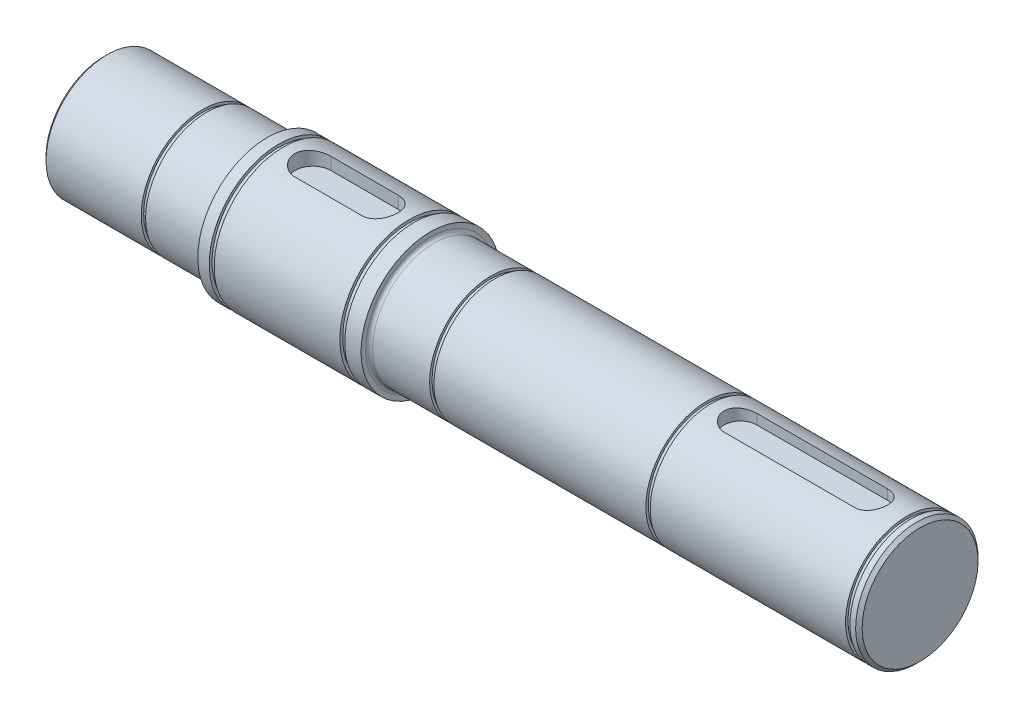
from build123d import *

# Parameters (mm, degrees)
ESQUISSE2_R              = 42.5
ESQUISSE2_R_2            = 40.75
ENL_V_MAT_EXTRU_1_DEPTH  = 3
ESQUISSE3_R              = 42.5
ESQUISSE3_R_2            = 40.75
ENL_V_MAT_EXTRU_2_DEPTH  = 3
ENL_V_MAT_EXTRU_3_DEPTH  = 9
ENL_V_MAT_EXTRU_4_DEPTH  = 7.5
CHANFREIN1_SIZE          = 2
ESQUISSE6_R              = 37.5
ESQUISSE6_R_2            = 36
ENL_V_MAT_EXTRU_5_DEPTH  = 2.65
ENL_V_START              = -2.65
ESQUISSE7_R              = 37.5
ESQUISSE7_R_2            = 36
ENL_V_MAT_EXTRU_6_DEPTH  = 2.65
ESQUISSE8_R              = 37.5
ESQUISSE8_R_2            = 36
ENL_V_MAT_EXTRU_7_DEPTH  = 2.65
ENL_V_START_2            = 2.65
ESQUISSE10_R             = 37.5
ESQUISSE10_R_2           = 36
ENL_V_MAT_EXTRU_11_DEPTH = 2.65


with BuildPart() as part:
    # Esquisse1 → Révolution1 (revolve)
    with BuildSketch(Plane.XY):
        with BuildLine():
            Line((0, 0), (0, 37.5))
            Line((0, 37.5), (97.9, 37.5))
            ThreePointArc((97.9, 37.5), (99.38492424, 38.11507576), (100, 39.6))
            Line((100, 39.6), (100, 42.5))
            Line((100, 42.5), (200, 42.5))
            Line((200, 42.5), (200, 39.6))
            ThreePointArc((200, 39.6), (200.61507576, 38.11507576), (202.1, 37.5))
            Line((202.1, 37.5), (500, 37.5))
            Line((500, 37.5), (500, 0))
            Line((500, 0), (0, 0))
        make_face()
    revolve(axis=Axis((500, 0, 0), (-1, 0, 0)))

    # Esquisse2 → Enlèv. mat.-Extru.1 (cut)
    with BuildSketch(Plane(origin=(110, 0, 0), x_dir=(0, 0, -1), z_dir=(1, 0, 0))):
        Circle(ESQUISSE2_R)
        Circle(ESQUISSE2_R_2, mode=Mode.SUBTRACT)
    extrude(amount=-ENL_V_MAT_EXTRU_1_DEPTH, mode=Mode.SUBTRACT)

    # Esquisse3 → Enlèv. mat.-Extru.2 (cut)
    with BuildSketch(Plane(origin=(190, 0, 0), x_dir=(0, 0, -1), z_dir=(1, 0, 0))):
        Circle(ESQUISSE3_R)
        Circle(ESQUISSE3_R_2, mode=Mode.SUBTRACT)
    extrude(amount=-ENL_V_MAT_EXTRU_2_DEPTH, mode=Mode.SUBTRACT)

    # Esquisse4 → Enlèv. mat.-Extru.3 (cut)
    with BuildSketch(Plane(origin=(0, 42.5, 0), x_dir=(1, 0, 0), z_dir=(0, 1, 0))):
        with BuildLine():
            Line((128, 11), (169, 11))
            ThreePointArc((169, 11), (180, 0), (169, -11))
            Line((169, -11), (128, -11))
            ThreePointArc((128, -11), (117, 0), (128, 11))
        make_face()
    extrude(amount=-ENL_V_MAT_EXTRU_3_DEPTH, mode=Mode.SUBTRACT)

    # Esquisse5 → Enlèv. mat.-Extru.4 (cut)
    with BuildSketch(Plane(origin=(0, 37.5, 0), x_dir=(1, 0, 0), z_dir=(0, 1, 0))):
        with BuildLine():
            Line((470, -10), (390, -10))
            ThreePointArc((390, -10), (380, 0), (390, 10))
            Line((390, 10), (470, 10))
            ThreePointArc((470, 10), (480, 0), (470, -10))
        make_face()
    extrude(amount=-ENL_V_MAT_EXTRU_4_DEPTH, mode=Mode.SUBTRACT)

    # Chanfrein1
    chanfrein1_edges = [part.edges().sort_by_distance(p)[0] for p in [
        (500, -37.5, 0),
        (0, -37.5, 0),
    ]]
    chamfer(chanfrein1_edges, length=CHANFREIN1_SIZE)

    # Esquisse6 → Enlèv. mat.-Extru.5 (cut)
    with BuildSketch(Plane(origin=(494.5, 0, 0), x_dir=(0, 0, -1), z_dir=(1, 0, 0))):
        Circle(ESQUISSE6_R)
        Circle(ESQUISSE6_R_2, mode=Mode.SUBTRACT)
    extrude(amount=-ENL_V_MAT_EXTRU_5_DEPTH, mode=Mode.SUBTRACT)

    # Esquisse7 → Enlèv. mat.-Extru.6 (cut)
    with BuildSketch(Plane.ZY.offset(-60.35).offset(ENL_V_START)):
        Circle(ESQUISSE7_R)
        Circle(ESQUISSE7_R_2, mode=Mode.SUBTRACT)
    extrude(amount=ENL_V_MAT_EXTRU_6_DEPTH, mode=Mode.SUBTRACT)

    # Esquisse8 → Enlèv. mat.-Extru.7 (cut)
    with BuildSketch(Plane.ZY.offset(-239.65)):
        Circle(ESQUISSE8_R)
        Circle(ESQUISSE8_R_2, mode=Mode.SUBTRACT)
    extrude(amount=ENL_V_MAT_EXTRU_7_DEPTH, mode=Mode.SUBTRACT)

    # Esquisse10 → Enlèv. mat.-Extru.11 (cut)
    with BuildSketch(Plane(origin=(369.5, 0, 0), x_dir=(0, 0, -1), z_dir=(1, 0, 0)).offset(ENL_V_START_2)):
        Circle(ESQUISSE10_R)
        Circle(ESQUISSE10_R_2, mode=Mode.SUBTRACT)
    extrude(amount=-ENL_V_MAT_EXTRU_11_DEPTH, mode=Mode.SUBTRACT)


solid = part.part
